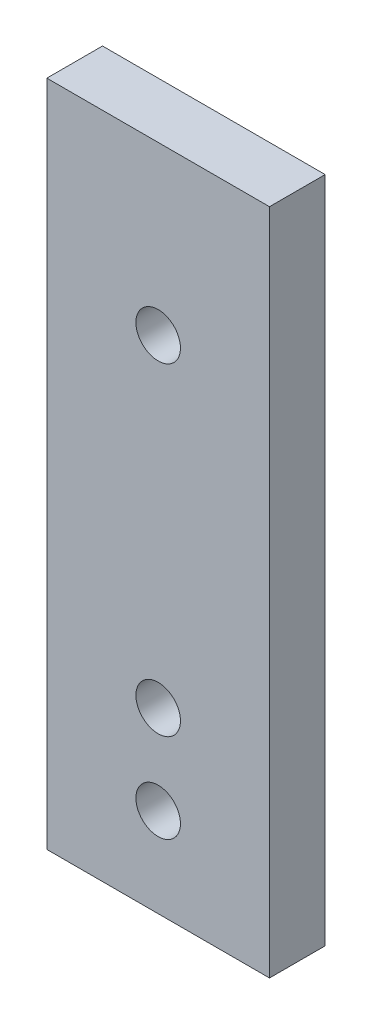
from build123d import *

# Parameters (mm, degrees)
SKETCH1_W           = 20
SKETCH1_H           = 60
SKETCH1_R           = 2
BOSS_EXTRUDE1_DEPTH = 5


with BuildPart() as part:
    # Sketch1 → Boss-Extrude1 (new body)
    with BuildSketch(Plane.XY):
        with Locations((10, 30)):
            Rectangle(SKETCH1_W, SKETCH1_H)
        with Locations((10, 45)):
            Circle(SKETCH1_R, mode=Mode.SUBTRACT)
        with Locations((10, 16)):
            Circle(SKETCH1_R, mode=Mode.SUBTRACT)
        with Locations((10, 8)):
            Circle(SKETCH1_R, mode=Mode.SUBTRACT)
    extrude(amount=BOSS_EXTRUDE1_DEPTH)


solid = part.part
